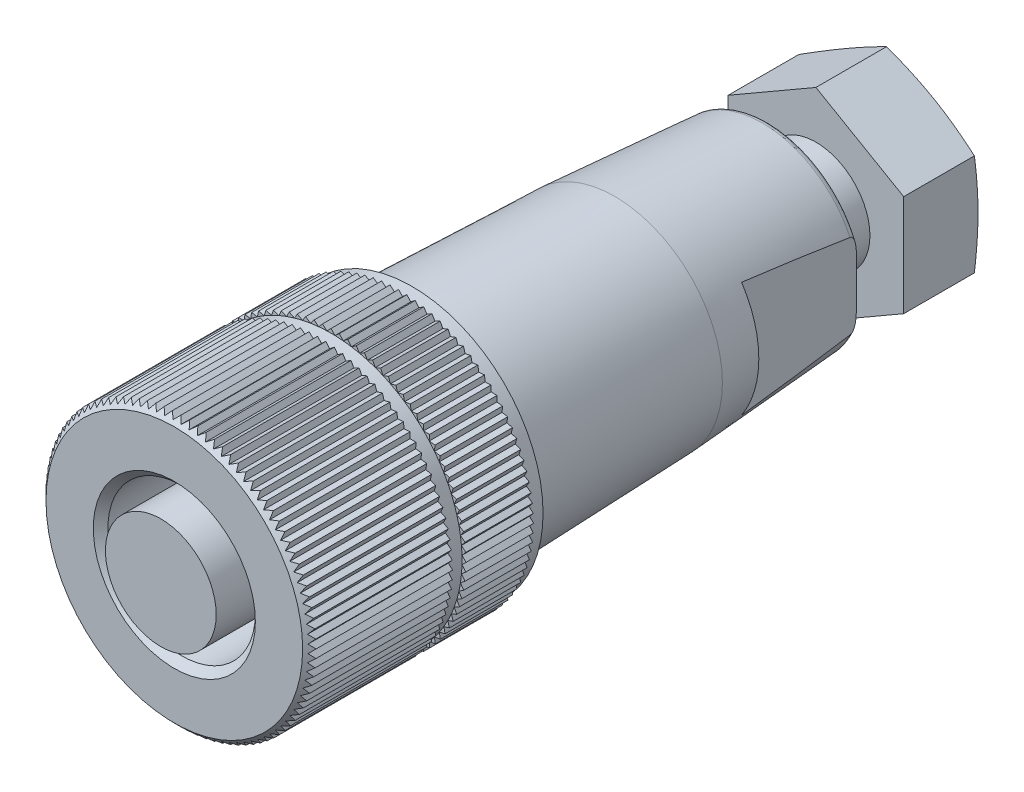
from build123d import *

# Parameters (mm, degrees)
SKIZZE3_W                       = 29.742277421
SKIZZE3_H                       = 29.781985063
SCHNITT_LINEAR_AUSTRAGEN1_DEPTH = 16.6
SKIZZE4_W                       = 34
SKIZZE4_H                       = 34
SCHNITT_LINEAR_AUSTRAGEN2_DEPTH = 6
SKIZZE5_W                       = 40
SKIZZE5_H                       = 60
SKIZZE5_W_2                     = 13
SKIZZE5_H_2                     = 40
SCHNITT_LINEAR_AUSTRAGEN3_DEPTH = 12
SKIZZE6_R                       = 3
SCHNITT_LINEAR_AUSTRAGEN4_DEPTH = 5


with BuildPart() as part:
    # Skizze1 → Rotation1 (revolve)
    with BuildSketch(Plane(origin=(0, 0, 0), x_dir=(0, 0, -1), z_dir=(1, 0, 0))):
        with BuildLine():
            Line((0, 0), (0, 4.1))
            Line((0, 4.1), (1, 4.1))
            Line((1, 4.1), (1, 9.5))
            Line((1, 9.5), (1.5, 10))
            Line((1.5, 10), (11.6, 10))
            Line((11.6, 10), (11.6, 9.7))
            Line((11.6, 9.7), (12.6, 9.7))
            Line((12.6, 9.7), (12.6, 10))
            Line((12.6, 10), (17.6, 10))
            Line((17.6, 10), (17.6, 9.7))
            Line((17.6, 9.7), (18.6, 9.7))
            Line((18.6, 9.7), (18.6, 8.5))
            Line((18.6, 8.5), (33.6, 7.976188458))
            Line((33.6, 7.976188458), (44.534878237, 7.211547284))
            ThreePointArc((44.534878237, 7.211547284), (44.865676851, 7.053764438), (45, 6.712765258))
            Line((45, 6.712765258), (45, 4))
            Line((45, 4), (48.5, 4))
            Line((48.5, 4), (48.5, 7.8))
            Line((48.5, 7.8), (53.65166605, 7.8))
            Line((53.65166605, 7.8), (54, 6.5))
            Line((54, 6.5), (54, 0))
            Line((54, 0), (0, 0))
        make_face()
    revolve(axis=Axis((0, 0, -54), (0, 0, 1)))

    # Skizze2 → Schnitt-Rotation1 (revolve, cut)
    with BuildSketch(Plane(origin=(0, 0, 0), x_dir=(0, 0, -1), z_dir=(1, 0, 0))):
        Polygon((1, 4.1), (8.2, 4.1), (8.2, 5.4585), (1.5415, 5.4585), (1, 6), align=None)
    revolve(axis=Axis((0, 0, -8.2), (0, 0, 1)), mode=Mode.SUBTRACT)

    # Skizze3 → Schnitt-Linear austragen1 (cut)
    with BuildSketch(Plane.XY.offset(-1)):
        with Locations((-1.295006749, -1.292722493)):
            Rectangle(SKIZZE3_W, SKIZZE3_H)
        Polygon((-9.999998525, -0.005431109), (-9.695043361, -0.310055204), (-9.979911029, -0.633542303), (-9.65642393, -0.918409971), (-9.920410152, -1.259151466), (-9.579668657, -1.523137688), (-9.821730879, -1.879787898), (-9.465080669, -2.121850119), (-9.684262921, -2.493000536), (-9.313112505, -2.712182788), (-9.508549177, -3.096367637), (-9.124364328, -3.29180431), (-9.295283588, -3.687506342), (-8.899581556, -3.858425602), (-9.045308397, -4.264082081), (-8.639651918, -4.409808922), (-8.759610826, -4.823817802), (-8.345601947, -4.943776709), (-8.43931917, -5.364502954), (-8.018592925, -5.458220178), (-8.085698349, -5.884002227), (-7.6599163, -5.951107651), (-7.700144908, -6.380263976), (-7.270988584, -6.420492584), (-7.284181501, -6.851328328), (-6.853345757, -6.864521245), (-6.839450883, -7.295334922), (-6.408637206, -7.281440047), (-6.367709413, -7.710530256), (-5.938619205, -7.669602463), (-5.870820129, -8.09527461), (-5.445147982, -8.027475534), (-5.35074538, -8.448048525), (-4.93017239, -8.353645923), (-4.809539083, -8.7674588), (-4.395726207, -8.646825494), (-4.24933861, -9.052243997), (-3.843920106, -8.9058564), (-3.672356343, -9.301279422), (-3.276933321, -9.129715659), (-3.080870943, -9.513581567), (-2.697005035, -9.317519189), (-2.477218346, -9.688311993), (-2.106425543, -9.468525304), (-1.863782541, -9.824780641), (-1.507527204, -9.582137639), (-1.242986152, -9.92244856), (-0.90267523, -9.657907508), (-0.617280872, -9.980930033), (-0.299676936, -9.700323064), (0, -10), (0.304789675, -9.695210325), (0.628122011, -9.980253641), (0.913165326, -9.656921305), (1.253763397, -9.921092548), (1.51793464, -9.580494477), (1.874453331, -9.822750364), (2.116709218, -9.466231673), (2.487740539, -9.685615469), (2.707124335, -9.314584147), (3.091202984, -9.510229446), (3.286848283, -9.126150797), (3.682457428, -9.297284942), (3.853591573, -8.901675797), (4.259168847, -9.047622933), (4.405115983, -8.642045659), (4.81905965, -8.762229402), (4.939243392, -8.348285735), (5.359918677, -8.442231445), (5.453864387, -8.021556161), (5.879609928, -8.088892822), (5.94694659, -7.663147282), (6.376081002, -7.703608963), (6.416542683, -7.274474551), (6.847371199, -7.287901458), (6.860798106, -6.857072943), (7.291619266, -6.84341205), (7.277958372, -6.41259089), (7.707070746, -6.371896147), (7.666376003, -5.942783774), (8.09208491, -5.875215895), (8.024517031, -5.449506988), (8.445141231, -5.355332818), (8.350967061, -4.934708619), (8.764845393, -4.814300077), (8.644436851, -4.400421744), (9.0499348, -4.254254356), (8.903767411, -3.848756407), (9.299283554, -3.677407428), (9.127934574, -3.281891286), (9.511906909, -3.086037419), (9.316053042, -2.702065083), (9.686965159, -2.482479809), (9.467379885, -2.111567692), (9.823766951, -1.869118212), (9.581317471, -1.512731145), (9.921772017, -1.248374959), (9.657415831, -0.907920412), (9.980593309, -0.622701533), (9.69537443, -0.299524055), (9.999998525, 0.005431109), (9.695043361, 0.310055204), (9.979911029, 0.633542303), (9.65642393, 0.918409971), (9.920410152, 1.259151466), (9.579668657, 1.523137688), (9.821730879, 1.879787898), (9.465080669, 2.121850119), (9.684262921, 2.493000536), (9.313112505, 2.712182788), (9.508549177, 3.096367637), (9.124364328, 3.29180431), (9.295283588, 3.687506342), (8.899581556, 3.858425602), (9.045308397, 4.264082081), (8.639651918, 4.409808922), (8.759610826, 4.823817802), (8.345601947, 4.943776709), (8.43931917, 5.364502954), (8.018592925, 5.458220178), (8.085698349, 5.884002227), (7.6599163, 5.951107651), (7.700144908, 6.380263976), (7.270988584, 6.420492584), (7.284181501, 6.851328328), (6.853345757, 6.864521245), (6.839450883, 7.295334922), (6.408637206, 7.281440047), (6.367709413, 7.710530256), (5.938619205, 7.669602463), (5.870820129, 8.09527461), (5.445147982, 8.027475534), (5.35074538, 8.448048525), (4.93017239, 8.353645923), (4.809539083, 8.7674588), (4.395726207, 8.646825494), (4.24933861, 9.052243997), (3.843920106, 8.9058564), (3.672356343, 9.301279422), (3.276933321, 9.129715659), (3.080870943, 9.513581567), (2.697005035, 9.317519189), (2.477218346, 9.688311993), (2.106425543, 9.468525304), (1.863782541, 9.824780641), (1.507527204, 9.582137639), (1.242986152, 9.92244856), (0.90267523, 9.657907508), (0.617280872, 9.980930033), (0.299676936, 9.700323064), (0, 10), (-0.304789675, 9.695210325), (-0.628122011, 9.980253641), (-0.913165326, 9.656921305), (-1.253763397, 9.921092548), (-1.51793464, 9.580494477), (-1.874453331, 9.822750364), (-2.116709218, 9.466231673), (-2.487740539, 9.685615469), (-2.707124335, 9.314584147), (-3.091202984, 9.510229446), (-3.286848283, 9.126150797), (-3.682457428, 9.297284942), (-3.853591573, 8.901675797), (-4.259168847, 9.047622933), (-4.405115983, 8.642045659), (-4.81905965, 8.762229402), (-4.939243392, 8.348285735), (-5.359918677, 8.442231445), (-5.453864387, 8.021556161), (-5.879609928, 8.088892822), (-5.94694659, 7.663147282), (-6.376081002, 7.703608963), (-6.416542683, 7.274474551), (-6.847371199, 7.287901458), (-6.860798106, 6.857072943), (-7.291619266, 6.84341205), (-7.277958372, 6.41259089), (-7.707070746, 6.371896147), (-7.666376003, 5.942783774), (-8.09208491, 5.875215895), (-8.024517031, 5.449506988), (-8.445141231, 5.355332818), (-8.350967061, 4.934708619), (-8.764845393, 4.814300077), (-8.644436851, 4.400421744), (-9.0499348, 4.254254356), (-8.903767411, 3.848756407), (-9.299283554, 3.677407428), (-9.127934574, 3.281891286), (-9.511906909, 3.086037419), (-9.316053042, 2.702065083), (-9.686965159, 2.482479809), (-9.467379885, 2.111567692), (-9.823766951, 1.869118212), (-9.581317471, 1.512731145), (-9.921772017, 1.248374959), (-9.657415831, 0.907920412), (-9.980593309, 0.622701533), (-9.69537443, 0.299524055), align=None, mode=Mode.SUBTRACT)
    extrude(amount=-SCHNITT_LINEAR_AUSTRAGEN1_DEPTH, mode=Mode.SUBTRACT)

    # Skizze4 → Schnitt-Linear austragen2 (cut)
    with BuildSketch(Plane.XY.offset(-48.5)):
        Rectangle(SKIZZE4_W, SKIZZE4_H)
        Polygon((-6.5, -3.75277675), (0, -7.505553499), (6.5, -3.75277675), (6.5, 3.75277675), (0, 7.505553499), (-6.5, 3.75277675), align=None, mode=Mode.SUBTRACT)
    extrude(amount=-SCHNITT_LINEAR_AUSTRAGEN2_DEPTH, mode=Mode.SUBTRACT)

    # Skizze5 → Schnitt-Linear austragen3 (cut)
    with BuildSketch(Plane.XY.offset(-48.5)):
        Rectangle(SKIZZE5_W, SKIZZE5_H)
        Rectangle(SKIZZE5_W_2, SKIZZE5_H_2, mode=Mode.SUBTRACT)
    extrude(amount=SCHNITT_LINEAR_AUSTRAGEN3_DEPTH, mode=Mode.SUBTRACT)

    # Skizze6 → Schnitt-Linear austragen4 (cut)
    with BuildSketch(Plane.XY.offset(-54)):
        Circle(SKIZZE6_R)
    extrude(amount=SCHNITT_LINEAR_AUSTRAGEN4_DEPTH, mode=Mode.SUBTRACT)


solid = part.part
